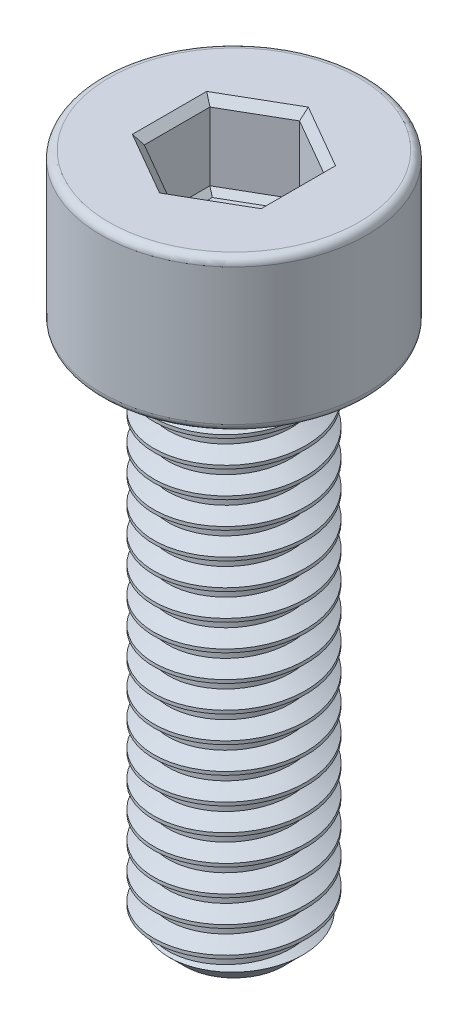
from build123d import *

# Parameters (mm, degrees)
SKETCH1_R           = 2
BOSS_EXTRUDE1_DEPTH = 14
THREAD1_PITCH       = 0.7
SKETCH4_R           = 3.5
BOSS_EXTRUDE2_DEPTH = 4
FILLET1_R           = 0.2
CUT_EXTRUDE1_DEPTH  = 2
CHAMFER1_SIZE       = 0.2
CUT_EXTRUDE2_DEPTH  = 0.15
CUT_EXTRUDE2_DRAFT  = -45


with BuildPart() as part:
    # Sketch1 → Boss-Extrude1 (new body)
    with BuildSketch(Plane(origin=(0, 0, 0), x_dir=(1, 0, 0), z_dir=(0, 1, 0))):
        with Locations(Location((0, 0, 0), (0, 0, 270))):
            Circle(SKETCH1_R)
    extrude(amount=BOSS_EXTRUDE1_DEPTH)

    # Thread1: arcs per turn and ends read off the stored shape
    # Thread1: the profile of Thread Profile1 profile screwed along a right-hand helix through 22.857147 turns, 6 arcs to a turn; built about Z, then put on its axis
    thread1_z = Axis((0, 0, 0), (0, 0, 1))
    thread1_corners = [(2.0003, 0, -0.000173205), (2.0003, 0, 0.612673203), (1.621113887, 0, 0.393749999), (1.621113887, 0, 0.218749999)]
    with BuildLine(mode=Mode.PRIVATE) as thread1_profile:
        Line(thread1_corners[0], thread1_corners[1])
        Line(thread1_corners[1], thread1_corners[2])
        Line(thread1_corners[2], thread1_corners[3])
        Line(thread1_corners[3], thread1_corners[0])
    thread1_cap = Face(thread1_profile.wire())
    thread1_turn_angles = [0, 30, 60, 90, 120, 150, 180, 210, 240, 270, 300, 330, 360]
    thread1_turn_weights = [1, 0.8660254037844387, 1, 0.8660254037844387, 1, 0.8660254037844387, 1, 0.8660254037844387, 1, 0.8660254037844387, 1, 0.8660254037844387, 1]
    thread1_turn_rails = [Edge.make_bspline([Vector(p[0], p[1], 0).rotate(thread1_z, thread1_turn_angles[k]) / thread1_turn_weights[k] + Vector(0, 0, p[2] + THREAD1_PITCH * thread1_turn_angles[k] / 360) for k in range(13)], [0, 0, 0, 1, 1, 2, 2, 3, 3, 4, 4, 5, 5, 6, 6, 6], 2, thread1_turn_weights) for p in thread1_corners]
    thread1_turn_sides = [Face.make_surface_from_curves(thread1_turn_rails[p[0]], thread1_turn_rails[p[1]]) for p in [(0, 1), (1, 2), (2, 3), (3, 0)]]
    thread1_last_angles = [7920, 7950, 7980, 8010, 8040, 8070, 8100, 8130, 8160, 8190, 8220, 8224.2865, 8228.573]
    thread1_last_weights = [1, 0.8660254037844387, 1, 0.8660254037844387, 1, 0.8660254037844387, 1, 0.8660254037844387, 1, 0.8660254037844387, 1, 0.9972027722911286, 1]
    thread1_last_rails = [Edge.make_bspline([Vector(p[0], p[1], 0).rotate(thread1_z, thread1_last_angles[k]) / thread1_last_weights[k] + Vector(0, 0, p[2] + THREAD1_PITCH * thread1_last_angles[k] / 360) for k in range(13)], [0, 0, 0, 1, 1, 2, 2, 3, 3, 4, 4, 5, 5, 6, 6, 6], 2, thread1_last_weights) for p in thread1_corners]
    thread1_last_sides = [Face.make_surface_from_curves(thread1_last_rails[p[0]], thread1_last_rails[p[1]]) for p in [(0, 1), (1, 2), (2, 3), (3, 0)]]
    thread1 = Plane(origin=(0, -1, 0), x_dir=(1, 0, 0), z_dir=(0, 1, 0)) * Solid(Shell([*[p.moved(Location((0, 0, THREAD1_PITCH * i))) for i in range(22) for p in thread1_turn_sides], *thread1_last_sides, thread1_cap, thread1_cap.rotate(thread1_z, 8228.573).moved(Location((0, 0, THREAD1_PITCH * 8228.573 / 360)))]))
    add(thread1, mode=Mode.SUBTRACT)

    # Sketch4 → Boss-Extrude2 (add)
    with BuildSketch(Plane(origin=(0, 14, 0), x_dir=(-1, 0, 0), z_dir=(0, -1, 0))):
        with Locations(Location((0, 0, 0), (0, 0, 90))):
            Circle(SKETCH4_R)
    extrude(amount=-BOSS_EXTRUDE2_DEPTH)

    # Fillet1
    fillet1_edges = [part.edges().sort_by_distance(p)[0] for p in [
        (0, 14, 3.5),
        (0, 18, 3.5),
    ]]
    fillet(fillet1_edges, radius=FILLET1_R)

    # Sketch6 → Cut-Revolve1 (revolve, cut)
    with BuildSketch(Plane.XY, mode=Mode.PRIVATE) as cut_revolve1_sk:
        Polygon((2.01, 0), (2.01, 0.7), (1.31, 0), align=None)
    revolve(cut_revolve1_sk.sketch.rotate(Axis((0, 0, 0), (0, 1, 0)), 202.132599438), axis=Axis((0, 0, 0), (0, 1, 0)), mode=Mode.SUBTRACT)

    # Sketch7 → Cut-Extrude1 (cut)
    with BuildSketch(Plane(origin=(0, 18, 0), x_dir=(1, 0, 0), z_dir=(0, 1, 0))):
        Polygon((0, 1.732050808), (-1.5, 0.866025404), (-1.5, -0.866025404), (0, -1.732050808), (1.5, -0.866025404), (1.5, 0.866025404), align=None)
    extrude(amount=-CUT_EXTRUDE1_DEPTH, mode=Mode.SUBTRACT)

    # Chamfer1
    chamfer1_edges = [part.edges().sort_by_distance(p)[0] for p in [
        (0.75, 18, -1.299038106),
        (-0.75, 18, -1.299038106),
        (-1.5, 18, 0),
        (-0.75, 18, 1.299038106),
        (0.75, 18, 1.299038106),
        (1.5, 18, 0),
    ]]
    chamfer(chamfer1_edges, length=CHAMFER1_SIZE)


with BuildPart() as cut_extrude2_tool:
    # Sketch8 → Cut-Extrude2 (with draft: the straight prism first)
    with BuildSketch(Plane(origin=(0, 16, 0), x_dir=(1, 0, 0), z_dir=(0, 1, 0))):
        Polygon((0, 1.732050808), (-1.5, 0.866025404), (-1.5, -0.866025404), (0, -1.732050808), (1.5, -0.866025404), (1.5, 0.866025404), align=None)
    extrude(amount=-CUT_EXTRUDE2_DEPTH)
    # Cut-Extrude2: the draft: its side faces are tilted about the plane it starts from
    cut_extrude2_sides = [cut_extrude2_tool.faces().sort_by_distance(p)[0] for p in [
        (-0.75, 15.925, -1.299038106),
        (-1.5, 15.925, 0),
        (-0.75, 15.925, 1.299038106),
        (0.75, 15.925, 1.299038106),
        (1.5, 15.925, 0),
        (0.75, 15.925, -1.299038106),
    ]]
    draft(cut_extrude2_sides, Plane(origin=(0, 16, 0), x_dir=(1, 0, 0), z_dir=(0, 1, 0)), CUT_EXTRUDE2_DRAFT)


with BuildPart() as part_1:
    add(part.part)

    # Cut-Extrude2: cut by cut_extrude2_tool
    add(cut_extrude2_tool.part, mode=Mode.SUBTRACT)


solid = part_1.part
